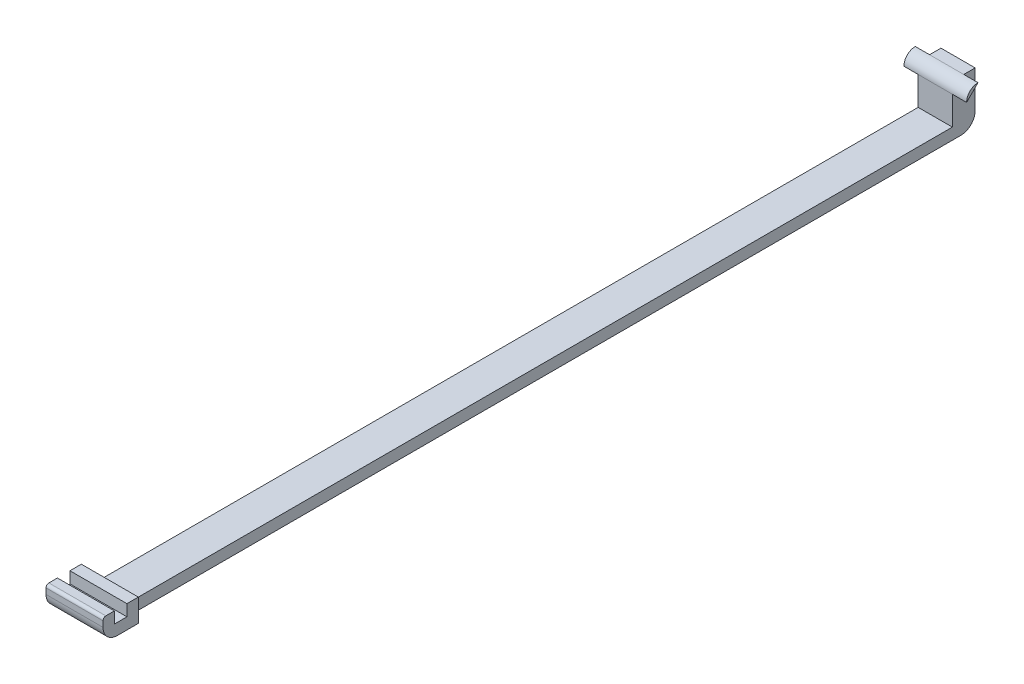
from build123d import *

# Parameters (mm, degrees)
SKETCH1_W                       = 39
SKETCH1_H                       = 155
BOSS_EXTRUDE1_DEPTH             = 2
BOSS_EXTRUDE2_DEPTH             = 38
SKETCH3_W                       = 2
SKETCH3_H                       = 2
BOSS_EXTRUDE3_DEPTH             = 38
SKETCH4_W                       = 2
SKETCH4_H                       = 2
BOSS_EXTRUDE4_DEPTH             = 151
SKETCH6_W                       = 35
SKETCH6_H                       = 2.2
CUT_EXTRUDE1_DEPTH              = 160.340045186
SKETCH7_W                       = 35
SKETCH7_H                       = 2.2
CUT_EXTRUDE2_DEPTH              = 89.490112442
SKETCH5_W                       = 31
SKETCH5_H                       = 2
BOSS_EXTRUDE5_DEPTH             = 2
BOSS_EXTRUDE6_REACH             = 91.367
SKETCH8_W                       = 2
SKETCH8_H                       = 2
BOSS_EXTRUDE6_DIRECTION_2_REACH = 91.367
SKETCH10_W                      = 2
SKETCH10_H                      = 2.2
SKETCH10_W_2                    = 2.2
SKETCH10_H_2                    = 2
BOSS_EXTRUDE8_DEPTH             = 2
SKETCH11_W                      = 2
SKETCH11_H                      = 2.2
SKETCH11_W_2                    = 2.2
SKETCH11_H_2                    = 2
BOSS_EXTRUDE9_DEPTH             = 2
FILLET2_R                       = 2.5
SKETCH14_W                      = 36.5
SKETCH14_H                      = 7.75
BOSS_EXTRUDE10_DEPTH            = 2
SKETCH13_W                      = 31
SKETCH13_H                      = 3
CUT_EXTRUDE4_DEPTH              = 2
FILLET3_R                       = 2
FILLET4_R                       = 0.5
SKETCH15_R                      = 5.1
CUT_EXTRUDE5_DEPTH              = 90.367219941
SKETCH16_R                      = 7.1
BOSS_EXTRUDE11_DEPTH            = 1
FILLET5_R                       = 0.5
CUT_EXTRUDE3_DEPTH              = 160.340045186
FILLET6_R                       = 0.4
FILLET7_R                       = 0.5
CUT_EXTRUDE8_DEPTH              = 90.367220028
CUT_EXTRUDE8_DEPTH_BACK         = 90.367220028
CUT_EXTRUDE11_DEPTH             = 81.420768473
CUT_EXTRUDE12_DEPTH             = 80.851424566
CUT_EXTRUDE13_DEPTH             = 2.5
SKETCH27_R                      = 5.1
BOSS_EXTRUDE12_DEPTH            = 2
CUT_EXTRUDE14_DEPTH             = 80.851424533
CUT_EXTRUDE14_DEPTH_BACK        = 80.851424533
SKETCH29_W                      = 92.7
SKETCH29_H                      = 1
SKETCH30_W                      = 2.5
SKETCH30_H                      = 155
CUT_EXTRUDE15_DEPTH             = 80.851424533
BOSS_EXTRUDE13_START            = -14.5
SKETCH31_W                      = 2
SKETCH31_H                      = 5.25
BOSS_EXTRUDE13_DEPTH            = 29
CUT_EXTRUDE16_DEPTH             = 80.35678925
BOSS_EXTRUDE14_DEPTH            = 5.5
BOSS_EXTRUDE14_DEPTH_BACK       = 5.5


with BuildPart() as part:
    # Sketch1 → Boss-Extrude1 (new body)
    with BuildSketch(Plane(origin=(0, 0, 0), x_dir=(1, 0, 0), z_dir=(0, 1, 0))):
        Rectangle(SKETCH1_W, SKETCH1_H)
    extrude(amount=BOSS_EXTRUDE1_DEPTH)

    # Sketch2 → Boss-Extrude2 (add)
    with BuildSketch(Plane(origin=(0, 2, 0), x_dir=(1, 0, 0), z_dir=(0, 1, 0))):
        Polygon((-17.5, -77.5), (-17.5, -75.5), (-17.5, 75.5), (17.5, 75.5), (17.5, -75.5), (17.5, -77.5), (19.5, -77.5), (19.5, 77.5), (-19.5, 77.5), (-19.5, -77.5), align=None)
    extrude(amount=BOSS_EXTRUDE2_DEPTH)

    # Sketch3 → Boss-Extrude3 (add)
    with BuildSketch(Plane(origin=(0, 2, 0), x_dir=(1, 0, 0), z_dir=(0, 1, 0))):
        with Locations((-16.5, -76.5)):
            Rectangle(SKETCH3_W, SKETCH3_H)
        with Locations((-16.5, -72.3)):
            Rectangle(SKETCH3_W, SKETCH3_H)
        with Locations((16.5, -76.5)):
            Rectangle(SKETCH3_W, SKETCH3_H)
        with Locations((16.5, -72.3)):
            Rectangle(SKETCH3_W, SKETCH3_H)
    extrude(amount=BOSS_EXTRUDE3_DEPTH)

    # Sketch4 → Boss-Extrude4 (add)
    with BuildSketch(Plane.XY.offset(-75.5)):
        with Locations((-16.5, 39)):
            Rectangle(SKETCH4_W, SKETCH4_H)
        Polygon((-15.5, 33.8), (-17.5, 31.8), (-17.5, 35.8), (-15.5, 35.8), align=None)
        Polygon((15.5, 35.8), (17.5, 35.8), (17.5, 31.8), (15.5, 33.8), align=None)
        with Locations((16.5, 39)):
            Rectangle(SKETCH4_W, SKETCH4_H)
    extrude(amount=BOSS_EXTRUDE4_DEPTH)

    # Sketch6 → Cut-Extrude1 (cut, through all)
    with BuildSketch(Plane.XY.offset(-75.5)):
        with Locations((0, 36.9)):
            Rectangle(SKETCH6_W, SKETCH6_H)
    extrude(amount=CUT_EXTRUDE1_DEPTH, mode=Mode.SUBTRACT)

    # Sketch7 → Cut-Extrude2 (cut, through all)
    with BuildSketch(Plane(origin=(0, 2, 0), x_dir=(1, 0, 0), z_dir=(0, 1, 0))):
        with Locations((0, -74.4)):
            Rectangle(SKETCH7_W, SKETCH7_H)
    extrude(amount=CUT_EXTRUDE2_DEPTH, mode=Mode.SUBTRACT)

    # Sketch5 → Boss-Extrude5 (add)
    with BuildSketch(Plane(origin=(0, 2, 0), x_dir=(1, 0, 0), z_dir=(0, 1, 0))):
        with Locations((0, -76.5)):
            Rectangle(SKETCH5_W, SKETCH5_H)
        with Locations((0, -72.3)):
            Rectangle(SKETCH5_W, SKETCH5_H)
    extrude(amount=BOSS_EXTRUDE5_DEPTH)

    # Boss-Extrude6: up to this face of the body (flat: up to its plane)
    boss_extrude6_end = Plane(part.part.faces().sort_by_distance((17.5, 16.9, -2.1))[0])
    # Sketch8 → Boss-Extrude6 (add, up to the picked face)
    with BuildSketch(Plane(origin=(0, 0, 0), x_dir=(0, 0, -1), z_dir=(1, 0, 0)), mode=Mode.PRIVATE) as boss_extrude6_sk1:
        with Locations((74.5, 39)):
            Rectangle(SKETCH8_W, SKETCH8_H)
    boss_extrude6_tool1 = split(extrude(boss_extrude6_sk1.sketch, amount=BOSS_EXTRUDE6_REACH, mode=Mode.PRIVATE), bisect_by=boss_extrude6_end, keep=Keep.BOTH, mode=Mode.PRIVATE)
    # Sketch8 → Boss-Extrude6 (add, up to the picked face)
    with BuildSketch(Plane(origin=(0, 0, 0), x_dir=(0, 0, -1), z_dir=(1, 0, 0)), mode=Mode.PRIVATE) as boss_extrude6_sk2:
        Polygon((75.5, 35.8), (73.5, 35.8), (73.5, 33.8), (75.5, 31.8), align=None)
    boss_extrude6_tool2 = split(extrude(boss_extrude6_sk2.sketch, amount=BOSS_EXTRUDE6_REACH, mode=Mode.PRIVATE), bisect_by=boss_extrude6_end, keep=Keep.BOTH, mode=Mode.PRIVATE)
    add(boss_extrude6_tool1.solids().sort_by(Axis((0, 39, -74.5), (1, 0, 0)))[0])
    add(boss_extrude6_tool2.solids().sort_by(Axis((0, 34.244444, -74.611111), (1, 0, 0)))[0])

    # Boss-Extrude6 direction 2: up to this face of the body (flat: up to its plane)
    boss_extrude6_direction_2_end = Plane(part.part.faces().sort_by_distance((-17.5, 16.9, -2.1))[0])
    # Sketch8 → Boss-Extrude6 direction 2 (add, up to the picked face)
    with BuildSketch(Plane(origin=(0, 0, 0), x_dir=(0, 0, -1), z_dir=(1, 0, 0)), mode=Mode.PRIVATE) as boss_extrude6_direction_2_sk1:
        with Locations((74.5, 39)):
            Rectangle(SKETCH8_W, SKETCH8_H)
    boss_extrude6_direction_2_tool1 = split(extrude(boss_extrude6_direction_2_sk1.sketch, amount=-BOSS_EXTRUDE6_DIRECTION_2_REACH, mode=Mode.PRIVATE), bisect_by=boss_extrude6_direction_2_end, keep=Keep.BOTH, mode=Mode.PRIVATE)
    # Sketch8 → Boss-Extrude6 direction 2 (add, up to the picked face)
    with BuildSketch(Plane(origin=(0, 0, 0), x_dir=(0, 0, -1), z_dir=(1, 0, 0)), mode=Mode.PRIVATE) as boss_extrude6_direction_2_sk2:
        Polygon((75.5, 35.8), (73.5, 35.8), (73.5, 33.8), (75.5, 31.8), align=None)
    boss_extrude6_direction_2_tool2 = split(extrude(boss_extrude6_direction_2_sk2.sketch, amount=-BOSS_EXTRUDE6_DIRECTION_2_REACH, mode=Mode.PRIVATE), bisect_by=boss_extrude6_direction_2_end, keep=Keep.BOTH, mode=Mode.PRIVATE)
    add(boss_extrude6_direction_2_tool1.solids().sort_by(Axis((0, 39, -74.5), (-1, 0, 0)))[0])
    add(boss_extrude6_direction_2_tool2.solids().sort_by(Axis((0, 34.244444, -74.611111), (-1, 0, 0)))[0])

    # Sketch10 → Boss-Extrude8 (add)
    with BuildSketch(Plane(origin=(-17.5, 0, 0), x_dir=(0, 0, -1), z_dir=(1, 0, 0))):
        with Locations((-76.5, 36.9)):
            Rectangle(SKETCH10_W, SKETCH10_H)
        with Locations((-74.4, 39)):
            Rectangle(SKETCH10_W_2, SKETCH10_H_2)
    extrude(amount=BOSS_EXTRUDE8_DEPTH)

    # Sketch11 → Boss-Extrude9 (add)
    with BuildSketch(Plane.ZY.offset(-17.5)):
        with Locations((76.5, 36.9)):
            Rectangle(SKETCH11_W, SKETCH11_H)
        with Locations((74.4, 39)):
            Rectangle(SKETCH11_W_2, SKETCH11_H_2)
    extrude(amount=BOSS_EXTRUDE9_DEPTH)

    # Fillet2
    fillet2_edges = [part.edges().sort_by_distance(p)[0] for p in [
        (-17.5, 16.9, 71.3),
        (17.5, 16.9, 71.3),
        (19.5, 20, 77.5),
        (-19.5, 20, 77.5),
        (-19.5, 20, -77.5),
        (-17.5, 16.9, -75.5),
        (17.5, 16.9, -75.5),
        (19.5, 20, -77.5),
        (19.5, 40, 0),
        (-19.5, 40, 0),
        (19.5, 0, 0),
        (-19.5, 0, 0),
        (0, 40, -77.5),
        (0, 0, 77.5),
        (0, 0, -77.5),
        (-17.5, 40, 77.5),
        (17.5, 40, 77.5),
    ]]
    fillet(fillet2_edges, radius=FILLET2_R)

    # Sketch14 → Boss-Extrude10 (add)
    with BuildSketch(Plane.XY.offset(-75.5)):
        with Locations((0, 5.125)):
            Rectangle(SKETCH14_W, SKETCH14_H)
    extrude(amount=BOSS_EXTRUDE10_DEPTH)

    # Sketch13 → Cut-Extrude4 (cut)
    with BuildSketch(Plane(origin=(0, 0, -77.5), x_dir=(-1, 0, 0), z_dir=(0, 0, -1))):
        with Locations((0, 5.5)):
            Rectangle(SKETCH13_W, SKETCH13_H)
    extrude(amount=-CUT_EXTRUDE4_DEPTH, mode=Mode.SUBTRACT)

    # Fillet3
    fillet3_edges = [part.edges().sort_by_distance(p)[0] for p in [
        (0, 9, -73.5),
    ]]
    fillet(fillet3_edges, radius=FILLET3_R - 0.0001)  # a hair under: the kernel refuses the full size

    # Fillet4
    fillet4_edges = [part.edges().sort_by_distance(p)[0] for p in [
        (15.5, 5.5, -75.5),
        (15.5, 4, -76.5),
        (0, 7, -75.5),
        (15.5, 7, -76.5),
        (-15.5, 5.5, -75.5),
        (-15.5, 7, -76.5),
        (0, 4, -75.5),
        (-15.5, 4, -76.5),
        (15.5, 5.5, -77.5),
        (0, 4, -77.5),
        (-15.5, 5.5, -77.5),
        (0, 7, -77.5),
    ]]
    fillet(fillet4_edges, radius=FILLET4_R)

    # Sketch15 → Cut-Extrude5 (cut, through all)
    with BuildSketch(Plane.XZ):
        with Locations(Location((0, 38.75, 0), (0, 0, 270))):
            Circle(SKETCH15_R)
        with Locations(Location((0, -38.75, 0), (0, 0, 270))):
            Circle(SKETCH15_R)
    extrude(amount=-CUT_EXTRUDE5_DEPTH, mode=Mode.SUBTRACT)

    # Sketch16 → Boss-Extrude11 (add)
    with BuildSketch(Plane(origin=(0, 2, 0), x_dir=(1, 0, 0), z_dir=(0, 1, 0))):
        with Locations(Location((0, 38.75, 0), (0, 0, 270))):
            Circle(SKETCH16_R)
        with Locations(Location((0, -38.75, 0), (0, 0, 270))):
            Circle(SKETCH16_R)
    extrude(amount=BOSS_EXTRUDE11_DEPTH)

    # Fillet5
    fillet5_edges = [part.edges().sort_by_distance(p)[0] for p in [
        (0, 2, -45.85),
        (0, 3, -45.85),
        (0, 2, 31.65),
        (0, 3, 31.65),
    ]]
    fillet(fillet5_edges, radius=FILLET5_R - 0.0001)  # a hair under: the kernel refuses the full size

    # Sketch12 → Cut-Extrude3 (cut, through all)
    with BuildSketch(Plane.XY.offset(-75.5)):
        with BuildLine():
            Line((1.668907005, 12.688040659), (2.22520934, 10.250720878))
            ThreePointArc((2.22520934, 10.250720878), (4.338837391, 10.990311321), (6.234898019, 12.181685175))
            Line((6.234898019, 12.181685175), (4.676173514, 14.136263881))
            ThreePointArc((4.676173514, 14.136263881), (3.254128043, 13.242733491), (1.668907005, 12.688040659))
        make_face()
        with BuildLine():
            ThreePointArc((-6.234898019, 12.181685175), (-4.338837391, 10.990311321), (-2.22520934, 10.250720878))
            Line((-2.22520934, 10.250720878), (-1.668907005, 12.688040659))
            ThreePointArc((-1.668907005, 12.688040659), (-3.254128043, 13.242733491), (-4.676173514, 14.136263881))
            Line((-4.676173514, 14.136263881), (-6.234898019, 12.181685175))
        make_face()
        with BuildLine():
            ThreePointArc((-10, 20), (-9.749279122, 17.77479066), (-9.009688679, 15.661162609))
            Line((-9.009688679, 15.661162609), (-6.757266509, 16.745871957))
            ThreePointArc((-6.757266509, 16.745871957), (-7.311959341, 18.331092995), (-7.5, 20))
            Line((-7.5, 20), (-10, 20))
        make_face()
        with BuildLine():
            ThreePointArc((-6.234898019, 27.818314825), (-7.818314825, 26.234898019), (-9.009688679, 24.338837391))
            Line((-9.009688679, 24.338837391), (-6.757266509, 23.254128043))
            ThreePointArc((-6.757266509, 23.254128043), (-5.863736119, 24.676173514), (-4.676173514, 25.863736119))
            Line((-4.676173514, 25.863736119), (-6.234898019, 27.818314825))
        make_face()
        with BuildLine():
            ThreePointArc((-1.668907005, 27.311959341), (-0.839733571, 27.452841574), (0, 27.5))
            Line((0, 27.5), (0, 30))
            ThreePointArc((0, 30), (-1.119644761, 29.937122099), (-2.22520934, 29.749279122))
            Line((-2.22520934, 29.749279122), (-1.668907005, 27.311959341))
        make_face()
        with BuildLine():
            Line((0, 30), (0, 27.5))
            ThreePointArc((0, 27.5), (0.839733571, 27.452841574), (1.668907005, 27.311959341))
            Line((1.668907005, 27.311959341), (2.22520934, 29.749279122))
            ThreePointArc((2.22520934, 29.749279122), (1.119644761, 29.937122099), (0, 30))
        make_face()
        with BuildLine():
            Line((6.757266509, 23.254128043), (9.009688679, 24.338837391))
            ThreePointArc((9.009688679, 24.338837391), (7.818314825, 26.234898019), (6.234898019, 27.818314825))
            Line((6.234898019, 27.818314825), (4.676173514, 25.863736119))
            ThreePointArc((4.676173514, 25.863736119), (5.863736119, 24.676173514), (6.757266509, 23.254128043))
        make_face()
        with BuildLine():
            Line((6.757266509, 16.745871957), (9.009688679, 15.661162609))
            ThreePointArc((9.009688679, 15.661162609), (9.749279122, 17.77479066), (10, 20))
            Line((10, 20), (7.5, 20))
            ThreePointArc((7.5, 20), (7.311959341, 18.331092995), (6.757266509, 16.745871957))
        make_face()
        with BuildLine():
            ThreePointArc((2.5, 20), (2.43731978, 19.443697665), (2.25242217, 18.915290652))
            Line((2.25242217, 18.915290652), (4.50484434, 17.830581304))
            ThreePointArc((4.50484434, 17.830581304), (4.874639561, 18.88739533), (5, 20))
            Line((5, 20), (2.5, 20))
        make_face()
        with BuildLine():
            ThreePointArc((1.558724505, 21.954578706), (1.954578706, 21.558724505), (2.25242217, 21.084709348))
            Line((2.25242217, 21.084709348), (4.50484434, 22.169418696))
            ThreePointArc((4.50484434, 22.169418696), (3.909157412, 23.117449009), (3.117449009, 23.909157412))
            Line((3.117449009, 23.909157412), (1.558724505, 21.954578706))
        make_face()
        with BuildLine():
            Line((0, 25), (0, 22.5))
            ThreePointArc((0, 22.5), (0.27991119, 22.484280525), (0.556302335, 22.43731978))
            Line((0.556302335, 22.43731978), (1.11260467, 24.874639561))
            ThreePointArc((1.11260467, 24.874639561), (0.559822381, 24.968561049), (0, 25))
        make_face()
        with BuildLine():
            ThreePointArc((-0.556302335, 22.43731978), (-0.27991119, 22.484280525), (0, 22.5))
            Line((0, 22.5), (0, 25))
            ThreePointArc((0, 25), (-0.559822381, 24.968561049), (-1.11260467, 24.874639561))
            Line((-1.11260467, 24.874639561), (-0.556302335, 22.43731978))
        make_face()
        with BuildLine():
            ThreePointArc((-2.25242217, 21.084709348), (-1.954578706, 21.558724505), (-1.558724505, 21.954578706))
            Line((-1.558724505, 21.954578706), (-3.117449009, 23.909157412))
            ThreePointArc((-3.117449009, 23.909157412), (-3.909157412, 23.117449009), (-4.50484434, 22.169418696))
            Line((-4.50484434, 22.169418696), (-2.25242217, 21.084709348))
        make_face()
        with BuildLine():
            ThreePointArc((-2.25242217, 18.915290652), (-2.43731978, 19.443697665), (-2.5, 20))
            Line((-2.5, 20), (-5, 20))
            ThreePointArc((-5, 20), (-4.874639561, 18.88739533), (-4.50484434, 17.830581304))
            Line((-4.50484434, 17.830581304), (-2.25242217, 18.915290652))
        make_face()
        with BuildLine():
            ThreePointArc((-3.117449009, 16.090842588), (-2.169418696, 15.49515566), (-1.11260467, 15.125360439))
            Line((-1.11260467, 15.125360439), (-0.556302335, 17.56268022))
            ThreePointArc((-0.556302335, 17.56268022), (-1.084709348, 17.74757783), (-1.558724505, 18.045421294))
            Line((-1.558724505, 18.045421294), (-3.117449009, 16.090842588))
        make_face()
        with BuildLine():
            Line((0.556302335, 17.56268022), (1.11260467, 15.125360439))
            ThreePointArc((1.11260467, 15.125360439), (2.169418696, 15.49515566), (3.117449009, 16.090842588))
            Line((3.117449009, 16.090842588), (1.558724505, 18.045421294))
            ThreePointArc((1.558724505, 18.045421294), (1.084709348, 17.74757783), (0.556302335, 17.56268022))
        make_face()
    extrude(amount=-CUT_EXTRUDE3_DEPTH, mode=Mode.SUBTRACT)

    # Fillet6
    fillet6_edges = [part.edges().sort_by_distance(p)[0] for p in [
        (5.863736119, 24.676173514, -75.5),
        (5.455535766, 26.841025472, -75.5),
        (7.818314825, 26.234898019, -77.5),
        (7.883477594, 23.796482717, -77.5),
        (5.863736119, 24.676173514, -77.5),
        (5.455535766, 26.841025472, -77.5),
        (7.883477594, 23.796482717, -75.5),
        (7.818314825, 26.234898019, -75.5),
        (7.311959341, 18.331092995, -75.5),
        (8.75, 20, -75.5),
        (9.749279122, 17.77479066, -77.5),
        (7.883477594, 16.203517283, -77.5),
        (7.311959341, 18.331092995, -77.5),
        (8.75, 20, -77.5),
        (7.883477594, 16.203517283, -75.5),
        (9.749279122, 17.77479066, -75.5),
        (2.43731978, 19.443697665, -75.5),
        (3.75, 20, -75.5),
        (4.874639561, 18.88739533, -77.5),
        (3.378633255, 18.372935978, -77.5),
        (2.43731978, 19.443697665, -77.5),
        (3.75, 20, -77.5),
        (3.378633255, 18.372935978, -75.5),
        (4.874639561, 18.88739533, -75.5),
        (1.954578706, 21.558724505, -75.5),
        (2.338086757, 22.931868059, -75.5),
        (3.909157412, 23.117449009, -77.5),
        (3.378633255, 21.627064022, -77.5),
        (1.954578706, 21.558724505, -77.5),
        (2.338086757, 22.931868059, -77.5),
        (3.378633255, 21.627064022, -75.5),
        (3.909157412, 23.117449009, -75.5),
        (0, 27.5, -75.5),
        (-1.947058172, 28.530619232, -75.5),
        (0, 30, -77.5),
        (1.947058172, 28.530619232, -77.5),
        (0, 27.5, -77.5),
        (-1.947058172, 28.530619232, -77.5),
        (1.947058172, 28.530619232, -75.5),
        (0, 30, -75.5),
        (-5.863736119, 24.676173514, -75.5),
        (-7.883477594, 23.796482717, -75.5),
        (-7.818314825, 26.234898019, -77.5),
        (-5.455535766, 26.841025472, -77.5),
        (-5.863736119, 24.676173514, -77.5),
        (-7.883477594, 23.796482717, -77.5),
        (-5.455535766, 26.841025472, -75.5),
        (-7.818314825, 26.234898019, -75.5),
        (-7.311959341, 18.331092995, -75.5),
        (-7.883477594, 16.203517283, -75.5),
        (-9.749279122, 17.77479066, -77.5),
        (-8.75, 20, -77.5),
        (-7.311959341, 18.331092995, -77.5),
        (-7.883477594, 16.203517283, -77.5),
        (-8.75, 20, -75.5),
        (-9.749279122, 17.77479066, -75.5),
        (-3.254128043, 13.242733491, -75.5),
        (-1.947058172, 11.469380768, -75.5),
        (-4.338837391, 10.990311321, -77.5),
        (-5.455535766, 13.158974528, -77.5),
        (-3.254128043, 13.242733491, -77.5),
        (-1.947058172, 11.469380768, -77.5),
        (-5.455535766, 13.158974528, -75.5),
        (-4.338837391, 10.990311321, -75.5),
        (1.084709348, 17.74757783, -75.5),
        (2.338086757, 17.068131941, -75.5),
        (2.169418696, 15.49515566, -77.5),
        (0.834453502, 16.344020329, -77.5),
        (1.084709348, 17.74757783, -77.5),
        (2.338086757, 17.068131941, -77.5),
        (0.834453502, 16.344020329, -75.5),
        (2.169418696, 15.49515566, -75.5),
        (-2.43731978, 19.443697665, -75.5),
        (-3.378633255, 18.372935978, -75.5),
        (-4.874639561, 18.88739533, -77.5),
        (-3.75, 20, -77.5),
        (-2.43731978, 19.443697665, -77.5),
        (-3.378633255, 18.372935978, -77.5),
        (-3.75, 20, -75.5),
        (-4.874639561, 18.88739533, -75.5),
        (-1.084709348, 17.74757783, -75.5),
        (-0.834453502, 16.344020329, -75.5),
        (-2.169418696, 15.49515566, -77.5),
        (-2.338086757, 17.068131941, -77.5),
        (-1.084709348, 17.74757783, -77.5),
        (-0.834453502, 16.344020329, -77.5),
        (-2.338086757, 17.068131941, -75.5),
        (-2.169418696, 15.49515566, -75.5),
        (-1.954578706, 21.558724505, -75.5),
        (-3.378633255, 21.627064022, -75.5),
        (-3.909157412, 23.117449009, -77.5),
        (-2.338086757, 22.931868059, -77.5),
        (-1.954578706, 21.558724505, -77.5),
        (-3.378633255, 21.627064022, -77.5),
        (-2.338086757, 22.931868059, -75.5),
        (-3.909157412, 23.117449009, -75.5),
        (0, 25, -77.5),
        (0.834453502, 23.655979671, -77.5),
        (0, 22.5, -75.5),
        (-0.834453502, 23.655979671, -75.5),
        (0, 22.5, -77.5),
        (-0.834453502, 23.655979671, -77.5),
        (0, 25, -75.5),
        (0.834453502, 23.655979671, -75.5),
        (3.254128043, 13.242733491, -75.5),
        (5.455535766, 13.158974528, -75.5),
        (4.338837391, 10.990311321, -77.5),
        (1.947058172, 11.469380768, -77.5),
        (3.254128043, 13.242733491, -77.5),
        (5.455535766, 13.158974528, -77.5),
        (1.947058172, 11.469380768, -75.5),
        (4.338837391, 10.990311321, -75.5),
    ]]
    fillet(fillet6_edges, radius=FILLET6_R)

    # Fillet7
    fillet7_edges = [part.edges().sort_by_distance(p)[0] for p in [
        (15.5, 40, 0.75),
        (0, 4, 77.5),
        (0, 40, -73.5),
        (-15.5, 40, 0.75),
        (-15.5, 20.75, 77.5),
        (-15.5, 39.267766953, 76.767766953),
        (15.5, 20.75, 77.5),
        (15.5, 39.267766953, 76.767766953),
    ]]
    fillet(fillet7_edges, radius=FILLET7_R)

    # Sketch20 → Cut-Extrude8 (cut, two sides: drawn at the far end of the back side and taken through both)
    with BuildSketch(Plane(origin=(0, 0, 0), x_dir=(0, 0, -1), z_dir=(1, 0, 0)).offset(-CUT_EXTRUDE8_DEPTH_BACK)):
        Polygon((77.5, 40), (77.5, 9), (75.5, 9), (73.5, 9), (73.5, 4), (-75.5, 4), (-77.5, 4), (-77.5, 40), align=None)
    extrude(amount=CUT_EXTRUDE8_DEPTH + CUT_EXTRUDE8_DEPTH_BACK, mode=Mode.SUBTRACT)

    # Sketch21 → Cut-Extrude11 (cut, through all)
    with BuildSketch(Plane(origin=(0, 0, 0), x_dir=(1, 0, 0), z_dir=(0, 1, 0))):
        Polygon((17, 77.5), (17, 73.5), (17, -77.5), (19.5, -77.5), (19.5, 77.5), align=None)
        Polygon((-17, 77.5), (-17, 73.5), (-17, -77.5), (-19.5, -77.5), (-19.5, 77.5), align=None)
    extrude(amount=CUT_EXTRUDE11_DEPTH, mode=Mode.SUBTRACT)

    # Sketch24 → Cut-Extrude12 (cut, through all)
    with BuildSketch(Plane(origin=(0, 0, 0), x_dir=(1, 0, 0), z_dir=(0, 1, 0))):
        Polygon((17, -77.5), (15, -77.5), (15, -71.3), (17, -70.3), align=None)
        Polygon((-17, -70.3), (-17, -77.5), (-15, -77.5), (-15, -71.3), align=None)
    extrude(amount=CUT_EXTRUDE12_DEPTH, mode=Mode.SUBTRACT)

    # Sketch26 → Cut-Extrude13 (cut)
    with BuildSketch(Plane(origin=(17, 0, 0), x_dir=(0, 0, -1), z_dir=(1, 0, 0))):
        Polygon((75.5, 9), (73.5, 7), (73.5, 9), align=None)
    cut_extrude13 = extrude(amount=-CUT_EXTRUDE13_DEPTH, mode=Mode.SUBTRACT)

    # Mirror1: Cut-Extrude13 across plane
    add(cut_extrude13.mirror(Plane(origin=(0, 0, 0), x_dir=(0, 0, 1), z_dir=(1, 0, 0))), mode=Mode.SUBTRACT)

    # Sketch27 → Boss-Extrude12 (add)
    with BuildSketch(Plane.XZ):
        with Locations((0, 38.75)):
            Circle(SKETCH27_R)
        with Locations((0, -38.75)):
            Circle(SKETCH27_R)
    extrude(amount=-BOSS_EXTRUDE12_DEPTH)

    # Sketch29 → Cut-Extrude14 (cut, two sides: drawn at the far end of the back side and taken through both)
    with BuildSketch(Plane(origin=(0, 0, 0), x_dir=(0, 0, -1), z_dir=(1, 0, 0)).offset(-CUT_EXTRUDE14_DEPTH_BACK)):
        with Locations((0, 2.5)):
            Rectangle(SKETCH29_W, SKETCH29_H)
    extrude(amount=CUT_EXTRUDE14_DEPTH + CUT_EXTRUDE14_DEPTH_BACK, mode=Mode.SUBTRACT)

    # Sketch30 → Cut-Extrude15 (cut, through all)
    with BuildSketch(Plane(origin=(0, 0, 0), x_dir=(1, 0, 0), z_dir=(0, 1, 0))):
        with Locations((-15.75, 0)):
            Rectangle(SKETCH30_W, SKETCH30_H)
        with Locations((15.75, 0)):
            Rectangle(SKETCH30_W, SKETCH30_H)
    extrude(amount=CUT_EXTRUDE15_DEPTH, mode=Mode.SUBTRACT)

    # Sketch31 → Boss-Extrude13 (add)
    with BuildSketch(Plane(origin=(0, 0, 0), x_dir=(0, 0, -1), z_dir=(1, 0, 0)).offset(BOSS_EXTRUDE13_START)):
        with Locations((76.5, 5.625)):
            Rectangle(SKETCH31_W, SKETCH31_H)
    extrude(amount=BOSS_EXTRUDE13_DEPTH)

    # Sketch32 → Cut-Extrude16 (cut, through all)
    with BuildSketch(Plane(origin=(0, 0, 0), x_dir=(1, 0, 0), z_dir=(0, 1, 0))):
        Polygon((14.5, 77.5), (3, 77.5), (3, -70.3), (5, -71.3), (5, -77.5), (14.5, -77.5), align=None)
        Polygon((-3, -70.3), (-3, 77.5), (-14.5, 77.5), (-14.5, -77.5), (-5, -77.5), (-5, -71.3), align=None)
    extrude(amount=CUT_EXTRUDE16_DEPTH, mode=Mode.SUBTRACT)

    # Sketch33 → Boss-Extrude14 (add, two sides: drawn at the far end of the back side and taken through both)
    with BuildSketch(Plane(origin=(0, 0, 0), x_dir=(0, 0, -1), z_dir=(1, 0, 0)).offset(-BOSS_EXTRUDE14_DEPTH_BACK)):
        with BuildLine():
            Line((75.5, 9), (73.5, 7))
            ThreePointArc((73.5, 7), (74.085786438, 8.414213562), (75.5, 9))
        make_face()
    extrude(amount=BOSS_EXTRUDE14_DEPTH + BOSS_EXTRUDE14_DEPTH_BACK)


solid = part.part
